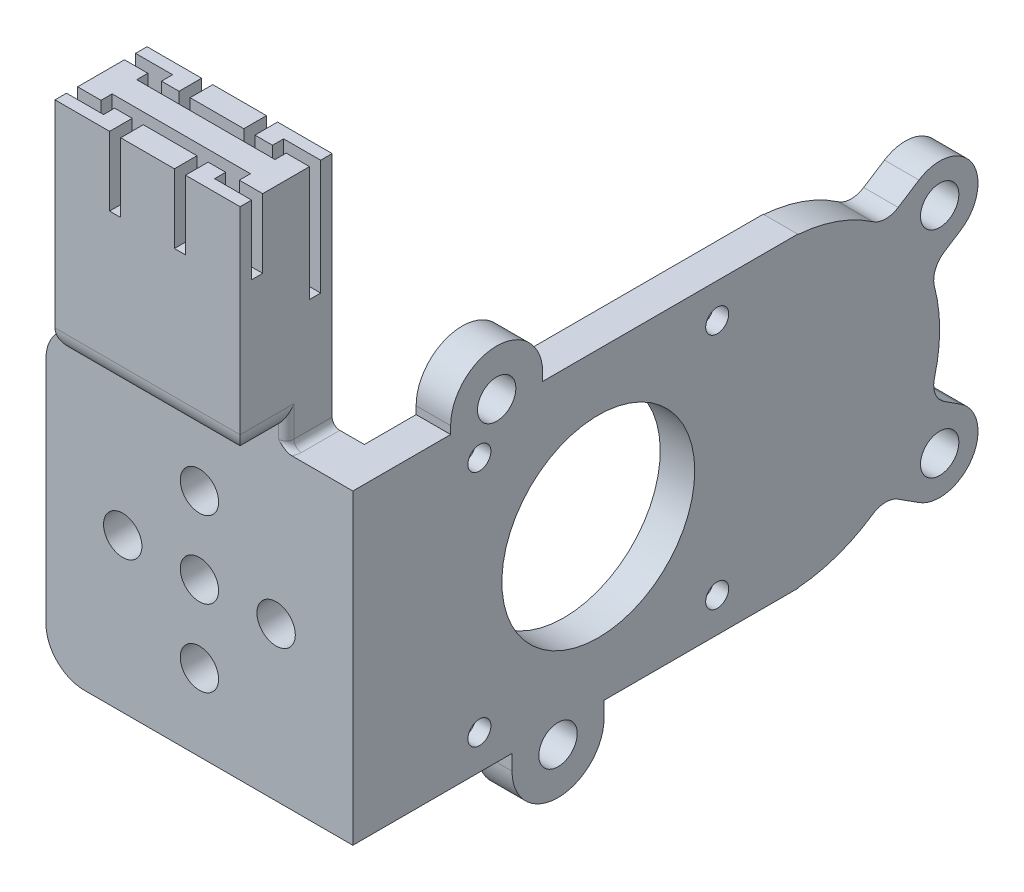
from build123d import *

# Parameters (mm, degrees)
SKETCH2_W             = 40
SKETCH2_H             = 40
SKETCH2_R             = 2.5
BOSS_EXTRUDE1_DEPTH   = 6
SKETCH3_W             = 4.5
SKETCH3_H             = 40
BOSS_EXTRUDE2_DEPTH   = 52
CUT_EXTRUDE1_REACH    = 72.882
SKETCH4_R             = 12.573151632
SKETCH4_R_2           = 1.5
SKETCH5_R             = 4.5
CUT_EXTRUDE2_DEPTH    = 1.5
SKETCH6_R             = 3
CUT_EXTRUDE3_DEPTH    = 2.5
FILLET1_R             = 5
BOSS_EXTRUDE3_START   = 15.748
BOSS_EXTRUDE3_DEPTH   = 15
BOSS_EXTRUDE3_2_DEPTH = 15
BOSS_EXTRUDE3_3_DEPTH = 15
SKETCH18_W            = 24.126809507
SKETCH18_H            = 12
BOSS_EXTRUDE12_DEPTH  = 15.748
SKETCH11_R            = 2.5
BOSS_EXTRUDE6_DEPTH   = 4.5
FILLET2_R             = 3
BOSS_EXTRUDE13_REACH  = 104.361
SKETCH9_R             = 2.5
SKETCH19_R            = 2.5
CUT_EXTRUDE7_DEPTH    = 4.5
SKETCH15_R            = 3
CUT_EXTRUDE8_DEPTH    = 2.5
SKETCH21_W            = 24.126809507
SKETCH21_H            = 2
CUT_EXTRUDE9_DEPTH    = 6
SKETCH22_W            = 1.45
SKETCH22_H            = 15
CUT_EXTRUDE10_DEPTH   = 3
SKETCH23_W            = 24.126809507
SKETCH23_H            = 4.3978
BOSS_EXTRUDE14_DEPTH  = 6
FILLET4_R             = 3
FILLET5_R             = 1
FILLET6_R             = 1


with BuildPart() as part:
    # Sketch2 → Boss-Extrude1 (new body)
    with BuildSketch(Plane.XY):
        Rectangle(SKETCH2_W, SKETCH2_H)
        Circle(SKETCH2_R, mode=Mode.SUBTRACT)
        with Locations((0, 10)):
            Circle(SKETCH2_R, mode=Mode.SUBTRACT)
        with Locations((0, -10)):
            Circle(SKETCH2_R, mode=Mode.SUBTRACT)
        with Locations((-10, 0)):
            Circle(SKETCH2_R, mode=Mode.SUBTRACT)
        with Locations((10, 0)):
            Circle(SKETCH2_R, mode=Mode.SUBTRACT)
    extrude(amount=-BOSS_EXTRUDE1_DEPTH)

    # Sketch3 → Boss-Extrude2 (add)
    with BuildSketch(Plane(origin=(0, 0, -6), x_dir=(-1, 0, 0), z_dir=(0, 0, -1))):
        with Locations((-17.75, 0)):
            Rectangle(SKETCH3_W, SKETCH3_H)
    extrude(amount=BOSS_EXTRUDE2_DEPTH)

    # Sketch4 → Cut-Extrude1 (cut, up to next)
    with BuildSketch(Plane.ZY.offset(-15.5), mode=Mode.PRIVATE) as cut_extrude1_sk1:
        with Locations(Location((-32, 0, 0), (0, 0, 270))):
            Circle(SKETCH4_R)
    cut_extrude1_tool1 = extrude(cut_extrude1_sk1.sketch, amount=-CUT_EXTRUDE1_REACH, mode=Mode.PRIVATE) & part.part
    # Sketch4 → Cut-Extrude1 (cut, up to next)
    with BuildSketch(Plane.ZY.offset(-15.5), mode=Mode.PRIVATE) as cut_extrude1_sk2:
        with Locations(Location((-16.5, 15.5, 0), (0, 0, 270))):
            Circle(SKETCH4_R_2)
    cut_extrude1_tool2 = extrude(cut_extrude1_sk2.sketch, amount=-CUT_EXTRUDE1_REACH, mode=Mode.PRIVATE) & part.part
    # Sketch4 → Cut-Extrude1 (cut, up to next)
    with BuildSketch(Plane.ZY.offset(-15.5), mode=Mode.PRIVATE) as cut_extrude1_sk3:
        with Locations(Location((-16.5, -15.5, 0), (0, 0, 270))):
            Circle(SKETCH4_R_2)
    cut_extrude1_tool3 = extrude(cut_extrude1_sk3.sketch, amount=-CUT_EXTRUDE1_REACH, mode=Mode.PRIVATE) & part.part
    # Sketch4 → Cut-Extrude1 (cut, up to next)
    with BuildSketch(Plane.ZY.offset(-15.5), mode=Mode.PRIVATE) as cut_extrude1_sk4:
        with Locations(Location((-47.5, -15.5, 0), (0, 0, 270))):
            Circle(SKETCH4_R_2)
    cut_extrude1_tool4 = extrude(cut_extrude1_sk4.sketch, amount=-CUT_EXTRUDE1_REACH, mode=Mode.PRIVATE) & part.part
    # Sketch4 → Cut-Extrude1 (cut, up to next)
    with BuildSketch(Plane.ZY.offset(-15.5), mode=Mode.PRIVATE) as cut_extrude1_sk5:
        with Locations(Location((-47.5, 15.5, 0), (0, 0, 270))):
            Circle(SKETCH4_R_2)
    cut_extrude1_tool5 = extrude(cut_extrude1_sk5.sketch, amount=-CUT_EXTRUDE1_REACH, mode=Mode.PRIVATE) & part.part
    add(cut_extrude1_tool1.solids().sort_by_distance((15.5, 0, -32))[0], mode=Mode.SUBTRACT)
    add(cut_extrude1_tool2.solids().sort_by_distance((15.5, 15.5, -16.5))[0], mode=Mode.SUBTRACT)
    add(cut_extrude1_tool3.solids().sort_by_distance((15.5, -15.5, -16.5))[0], mode=Mode.SUBTRACT)
    add(cut_extrude1_tool4.solids().sort_by_distance((15.5, -15.5, -47.5))[0], mode=Mode.SUBTRACT)
    add(cut_extrude1_tool5.solids().sort_by_distance((15.5, 15.5, -47.5))[0], mode=Mode.SUBTRACT)

    # Sketch5 → Cut-Extrude2 (cut)
    with BuildSketch(Plane(origin=(0, 0, -6), x_dir=(-1, 0, 0), z_dir=(0, 0, -1))):
        with Locations((0, 10)):
            Circle(SKETCH5_R)
        Circle(SKETCH5_R)
        with Locations((10, 0)):
            Circle(SKETCH5_R)
        with Locations((0, -10)):
            Circle(SKETCH5_R)
        with Locations((-10, 0)):
            Circle(SKETCH5_R)
    extrude(amount=-CUT_EXTRUDE2_DEPTH, mode=Mode.SUBTRACT)

    # Sketch6 → Cut-Extrude3 (cut)
    with BuildSketch(Plane.ZY.offset(-15.5)):
        with Locations(Location((-16.5, 15.5, 0), (0, 0, 270))):
            Circle(SKETCH6_R)
        with Locations(Location((-47.5, 15.5, 0), (0, 0, 270))):
            Circle(SKETCH6_R)
        with Locations(Location((-47.5, -15.5, 0), (0, 0, 270))):
            Circle(SKETCH6_R)
        with Locations(Location((-16.5, -15.5, 0), (0, 0, 270))):
            Circle(SKETCH6_R)
    extrude(amount=-CUT_EXTRUDE3_DEPTH, mode=Mode.SUBTRACT)

    # Fillet1
    fillet1_edges = [part.edges().sort_by_distance(p)[0] for p in [
        (-20, 20, -3),
        (-20, -20, -3),
    ]]
    fillet(fillet1_edges, radius=FILLET1_R)



with BuildPart() as body_2:
    # Sketch7 → Boss-Extrude3 (new body)
    with BuildSketch(Plane(origin=(0, 20, 0), x_dir=(1, 0, 0), z_dir=(0, 1, 0)).offset(BOSS_EXTRUDE3_START)):
        Polygon((11.301505506, -6), (-12.825304001, -6), (-12.825304001, -4.5), (-7.9999421, -4.5), (-7.9999421, -3.0522), (6.476143604, -3.0522), (6.476143604, -4.5), (11.301505506, -4.5), align=None)
    extrude(amount=BOSS_EXTRUDE3_DEPTH)


with BuildPart() as body_3:
    # Sketch7 → Boss-Extrude3 2 (new body)
    with BuildSketch(Plane(origin=(0, 20, 0), x_dir=(1, 0, 0), z_dir=(0, 1, 0)).offset(BOSS_EXTRUDE3_START)):
        Polygon((6.476143604, 3.0522), (-7.9999421, 3.0522), (-7.9999421, 4.5), (-12.825304001, 4.5), (-12.825304001, 6), (11.301505506, 6), (11.301505506, 4.5), (6.476143604, 4.5), align=None)
    extrude(amount=BOSS_EXTRUDE3_2_DEPTH)


with BuildPart() as body_4:
    # Sketch7 → Boss-Extrude3 3 (new body)
    with BuildSketch(Plane(origin=(0, 20, 0), x_dir=(1, 0, 0), z_dir=(0, 1, 0)).offset(BOSS_EXTRUDE3_START)):
        Polygon((-12.825304001, 3.0522), (-12.825304001, -3.0522), (-9.777707011, -3.0522), (-9.777707011, -1.6022), (8.253908515, -1.6022), (8.253908515, -3.0522), (11.301505506, -3.0522), (11.301505506, 3.0522), (8.253908515, 3.0522), (8.253908515, 1.6022), (-9.777707011, 1.6022), (-9.777707011, 3.0522), align=None)
    extrude(amount=BOSS_EXTRUDE3_3_DEPTH)


with BuildPart() as part_1:
    add(part.part)

    add(body_2.part)  # Boss-Extrude12 merges body 2

    add(body_3.part)  # Boss-Extrude12 merges body 3

    add(body_4.part)  # Boss-Extrude12 merges body 4
    # Sketch18 → Boss-Extrude12 (add)
    with BuildSketch(Plane.XZ.offset(-35.748)):
        with Locations((-0.761899247, 0)):
            Rectangle(SKETCH18_W, SKETCH18_H)
    extrude(amount=BOSS_EXTRUDE12_DEPTH)

    # Sketch11 → Boss-Extrude6 (add)
    # profile 1 of 3: a face of its own
    with BuildSketch(Plane.ZY.offset(-15.5)):
        with BuildLine():
            Line((-58, -19.943670675), (-58, 19.943670675))
            ThreePointArc((-58, 19.943670675), (-64.026515977, 18.5297479), (-69.332027993, 15.34076457))
            ThreePointArc((-69.332027993, 15.34076457), (-72.76360296, 11.640241353), (-75.159610133, 7.198538025))
            ThreePointArc((-75.159610133, 7.198538025), (-76.5, 0), (-75.159610133, -7.198538025))
            ThreePointArc((-75.159610133, -7.198538025), (-72.76360296, -11.640241353), (-69.332027993, -15.34076457))
            ThreePointArc((-69.332027993, -15.34076457), (-64.026515977, -18.5297479), (-58, -19.943670675))
        make_face()
    # profile 2 of 3: a face of its own
    with BuildSketch(Plane.ZY.offset(-15.5)):
        with BuildLine():
            ThreePointArc((-75.159610133, 7.198538025), (-72.76360296, 11.640241353), (-69.332027993, 15.34076457))
            Line((-69.332027993, 15.34076457), (-73.799349609, 18.20790773))
            ThreePointArc((-73.799349609, 18.20790773), (-80.70790773, 16.700650391), (-79.200650391, 9.79209227))
            Line((-79.200650391, 9.79209227), (-75.159610133, 7.198538025))
        make_face()
        with Locations(Location((-76.5, 14, 0), (0, 0, 270))):
            Circle(SKETCH11_R, mode=Mode.SUBTRACT)
    # profile 3 of 3: a face of its own
    with BuildSketch(Plane.ZY.offset(-15.5)):
        with BuildLine():
            Line((-73.799349609, -18.20790773), (-69.332027993, -15.34076457))
            ThreePointArc((-69.332027993, -15.34076457), (-72.76360296, -11.640241353), (-75.159610133, -7.198538025))
            Line((-75.159610133, -7.198538025), (-79.200650391, -9.79209227))
            ThreePointArc((-79.200650391, -9.79209227), (-80.70790773, -16.700650391), (-73.799349609, -18.20790773))
        make_face()
        with Locations(Location((-76.5, -14, 0), (0, 0, 270))):
            Circle(SKETCH11_R, mode=Mode.SUBTRACT)
    extrude(amount=-BOSS_EXTRUDE6_DEPTH)

    # Fillet2
    fillet2_edges = [part_1.edges().sort_by_distance(p)[0] for p in [
        (17.75, -15.34076457, -69.332027993),
        (17.75, -7.198538025, -75.159610133),
        (17.75, 7.198538025, -75.159610133),
        (17.75, 15.34076457, -69.332027993),
    ]]
    fillet(fillet2_edges, radius=FILLET2_R)

    # Boss-Extrude13: up to this face of the body (flat: up to its plane)
    boss_extrude13_end = Plane(part_1.part.faces().sort_by_distance((20, 18.017606594, -62.814692575))[0])
    # Sketch9 → Boss-Extrude13 (add, up to the picked face)
    with BuildSketch(Plane.ZY.offset(-15.5), mode=Mode.PRIVATE) as boss_extrude13_sk1:
        with BuildLine():
            Line((-32.75, -22), (-32.75, -18.434411342))
            Line((-32.75, -18.434411342), (-20.75, -18.434411342))
            Line((-20.75, -18.434411342), (-20.75, -22))
            ThreePointArc((-20.75, -22), (-26.75, -28), (-32.75, -22))
        make_face()
        with Locations((-26.75, -22)):
            Circle(SKETCH9_R, mode=Mode.SUBTRACT)
    boss_extrude13_tool1 = split(extrude(boss_extrude13_sk1.sketch, amount=-BOSS_EXTRUDE13_REACH, mode=Mode.PRIVATE), bisect_by=boss_extrude13_end, keep=Keep.BOTH, mode=Mode.PRIVATE)
    # Sketch9 → Boss-Extrude13 (add, up to the picked face)
    with BuildSketch(Plane.ZY.offset(-15.5), mode=Mode.PRIVATE) as boss_extrude13_sk2:
        with BuildLine():
            Line((-24.75, 21), (-24.75, 17.603718698))
            Line((-24.75, 17.603718698), (-12.75, 17.603718698))
            Line((-12.75, 17.603718698), (-12.75, 21))
            ThreePointArc((-12.75, 21), (-18.75, 27), (-24.75, 21))
        make_face()
        with Locations((-18.75, 21)):
            Circle(SKETCH9_R, mode=Mode.SUBTRACT)
    boss_extrude13_tool2 = split(extrude(boss_extrude13_sk2.sketch, amount=-BOSS_EXTRUDE13_REACH, mode=Mode.PRIVATE), bisect_by=boss_extrude13_end, keep=Keep.BOTH, mode=Mode.PRIVATE)
    add(boss_extrude13_tool1.solids().sort_by(Axis((15.5, -20.217206, -32.59654), (1, 0, 0)))[0])
    add(boss_extrude13_tool2.solids().sort_by(Axis((15.5, 19.301859, -24.597589), (1, 0, 0)))[0])

    # Sketch19 → Cut-Extrude7 (cut)
    with BuildSketch(Plane.ZY.offset(-15.5)):
        with Locations(Location((-18.75, 21, 0), (0, 0, 270))):
            Circle(SKETCH19_R)
        with Locations(Location((-26.75, -22, 0), (0, 0, 270))):
            Circle(SKETCH19_R)
    extrude(amount=-CUT_EXTRUDE7_DEPTH, mode=Mode.SUBTRACT)

    # Sketch15 → Cut-Extrude8 (cut)
    with BuildSketch(Plane.ZY.offset(-15.5)):
        with Locations(Location((-16.5, 15.5, 0), (0, 0, 270))):
            Circle(SKETCH15_R)
    extrude(amount=-CUT_EXTRUDE8_DEPTH, mode=Mode.SUBTRACT)

    # Sketch21 → Cut-Extrude9 (cut)
    with BuildSketch(Plane.XY.offset(6)):
        with Locations((-0.761899247, 21)):
            Rectangle(SKETCH21_W, SKETCH21_H)
    extrude(amount=-CUT_EXTRUDE9_DEPTH, mode=Mode.SUBTRACT)

    # Sketch22 → Cut-Extrude10 (cut)
    with BuildSketch(Plane.XY.offset(6)):
        with Locations((-4.986899248, 43.248)):
            Rectangle(SKETCH22_W, SKETCH22_H)
        with Locations((3.463100752, 43.248)):
            Rectangle(SKETCH22_W, SKETCH22_H)
    cut_extrude10 = extrude(amount=-CUT_EXTRUDE10_DEPTH, mode=Mode.SUBTRACT)

    # Mirror6: Cut-Extrude10 across plane
    add(cut_extrude10.mirror(Plane.XY), mode=Mode.SUBTRACT)

    # Sketch23 → Boss-Extrude14 (add)
    with BuildSketch(Plane(origin=(0, 35.748, 0), x_dir=(1, 0, 0), z_dir=(0, 1, 0))):
        with Locations((-0.761899247, -3.8011)):
            Rectangle(SKETCH23_W, SKETCH23_H)
    extrude(amount=BOSS_EXTRUDE14_DEPTH)

    # Fillet4
    fillet4_edges = [part_1.edges().sort_by_distance(p)[0] for p in [
        (-12.825304001, 22, 3),
        (11.301505506, 22, 3),
        (-0.761899248, 22, 6),
    ]]
    fillet(fillet4_edges, radius=FILLET4_R)

    # Fillet5
    fillet5_edges = [part_1.edges().sort_by_distance(p)[0] for p in [
        (-12.825304001, 22.5, 0),
        (11.301505506, 22.5, 0),
    ]]
    fillet(fillet5_edges, radius=FILLET5_R)

    # Fillet6
    # the kernel refuses this fillet: 1 mm, written as the material it adds along each edge
    with BuildSketch(Plane(origin=(-12.825304001, 20, -6), x_dir=(0, 1, 0), z_dir=(0, 0, 1)), Plane(origin=(11.301505506, 20, -1), x_dir=(0, 1, 0), z_dir=(0, 0, -1))) as fillet6_piece_1:
        with BuildLine():
            CenterArc((FILLET6_R, FILLET6_R), FILLET6_R, 180, 90)
            Line((0, FILLET6_R), (0, 0))
            Line((0, 0), (FILLET6_R, 0))
        make_face()
    extrude(amount=5)
    with BuildSketch(Plane(origin=(-11.825304001, 20, -1), x_dir=(-1, 0, 0), z_dir=(0, 0, -1))) as fillet6_piece_2_section:
        with BuildLine():
            CenterArc((1 + FILLET6_R, FILLET6_R), FILLET6_R, 180, 90)
            Line((1 + FILLET6_R, 0), (1, 0))
            Line((1, 0), (1, FILLET6_R))
        make_face()
    fillet6_piece_2 = revolve(axis=Axis((-11.825304001, 20, -1), (0, 1, 0)), revolution_arc=233.296989237, mode=Mode.PRIVATE)
    fillet6_piece_2 = split(fillet6_piece_2, bisect_by=Plane(origin=(-12.575242997, 20.3116281, 0), z_dir=(0, 0, -1)), keep=Keep.TOP, mode=Mode.PRIVATE)
    add(fillet6_piece_2)
    with BuildSketch(Plane(origin=(10.301505506, 20, -1), x_dir=(1, 0, 0), z_dir=(0, 0, -1))) as fillet6_piece_3_section:
        with BuildLine():
            CenterArc((1 + FILLET6_R, -FILLET6_R), FILLET6_R, 90, 90)
            Line((1 + FILLET6_R, 0), (1, 0))
            Line((1, 0), (1, -FILLET6_R))
        make_face()
    fillet6_piece_3 = revolve(axis=Axis((10.301505506, 20, -1), (0, -1, 0)), revolution_arc=233.296989237, mode=Mode.PRIVATE)
    fillet6_piece_3 = split(fillet6_piece_3, bisect_by=Plane(origin=(11.051444387, 20.311628394, 0), z_dir=(0, 0, -1)), keep=Keep.TOP, mode=Mode.PRIVATE)
    add(fillet6_piece_3)


solid = part_1.part
